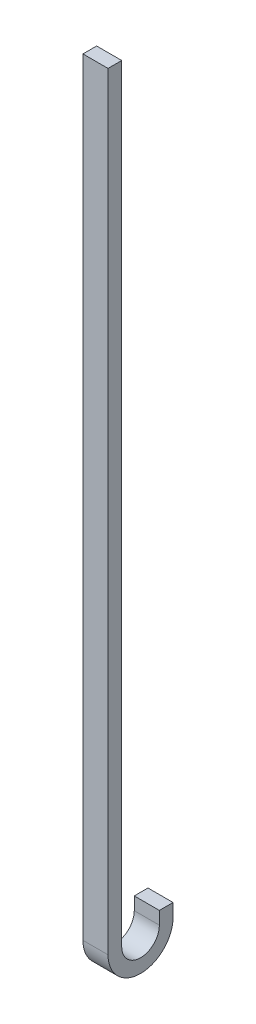
from build123d import *

# Parameters (mm, degrees)
BOSS_EXTRUDE1_DEPTH = 27.432


with BuildPart() as part:
    # Sketch1 → Boss-Extrude1 (new body)
    with BuildSketch(Plane(origin=(0, 0, 0), x_dir=(0, 0, -1), z_dir=(1, 0, 0))):
        with BuildLine():
            Line((0, 0), (0, -839.492482619))
            ThreePointArc((0, -839.492482619), (35.56, -875.052482619), (71.12, -839.492482619))
            Line((71.12, -839.492482619), (71.12, -825.5))
            Line((71.12, -825.5), (56.134, -825.5))
            Line((56.134, -825.5), (56.134, -839.492482619))
            ThreePointArc((56.134, -839.492482619), (35.56, -860.066482619), (14.986, -839.492482619))
            Line((14.986, -839.492482619), (14.986, 0))
            Line((14.986, 0), (0, 0))
        make_face()
    extrude(amount=BOSS_EXTRUDE1_DEPTH)


solid = part.part
